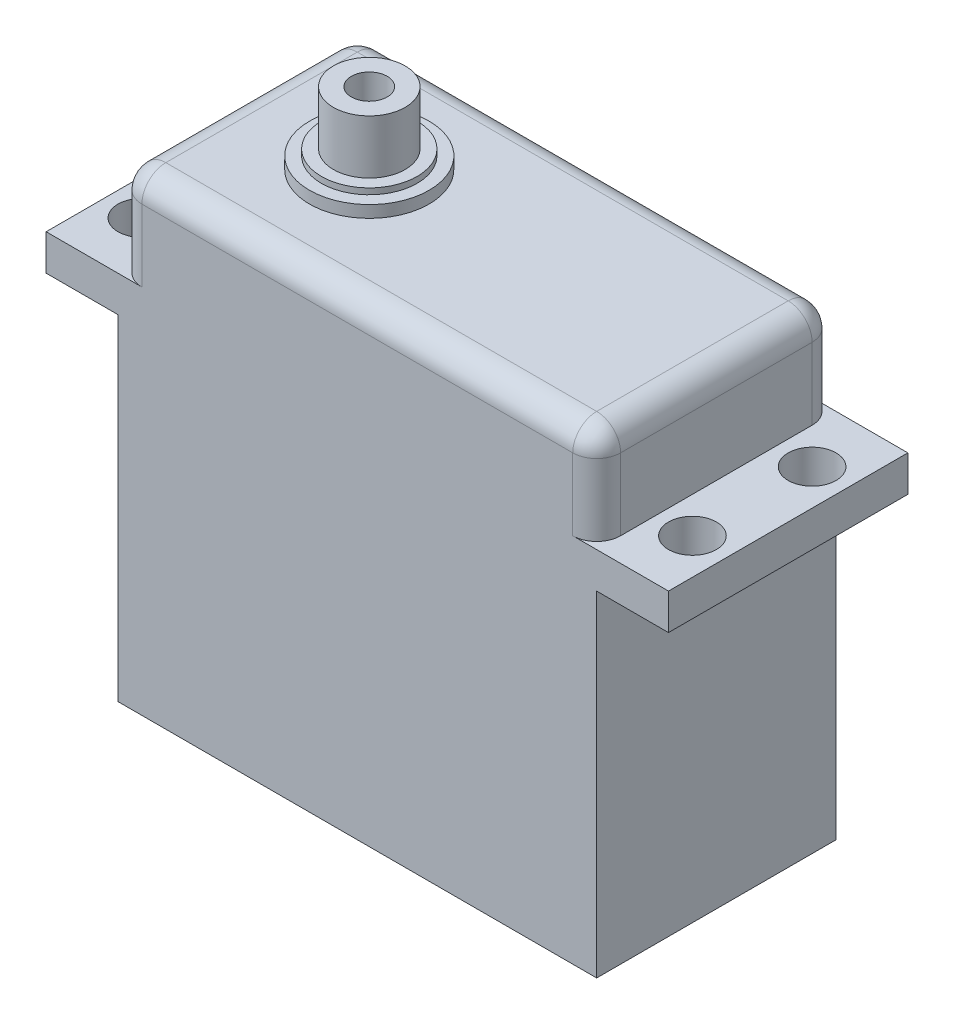
from build123d import *

# Parameters (mm, degrees)
SKETCH_2_W          = 40
SKETCH_2_H          = 39
EXTRUDE_1_DEPTH     = 20
SKETCH_3_W          = 20
SKETCH_3_H          = 3.004174972
EXTRUDE_3_DEPTH     = 6
EXTRUDE_4_DEPTH     = 6
SKETCH_6_R          = 2
CUT_EXTRUDE_7_DEPTH = 4.5
SKETCH_11_R         = 5
EXTRUDE_5_DEPTH     = 1
SKETCH_12_R         = 4
EXTRUDE_6_DEPTH     = 0.5
SKETCH_13_R         = 3
EXTRUDE_7_DEPTH     = 4.5
SKETCH_14_R         = 1.5
CUT_EXTRUDE_8_DEPTH = 7.75
FILLET_8_R          = 2


with BuildPart() as part:
    # 草图2 → 凸台-拉伸1 (new body)
    with BuildSketch(Plane.XY):
        with Locations((-1.314168378, -3.996919918)):
            Rectangle(SKETCH_2_W, SKETCH_2_H)
    extrude(amount=EXTRUDE_1_DEPTH)

    # 草图3 → 凸台-拉伸3 (add)
    with BuildSketch(Plane(origin=(18.685831622, 0, 0), x_dir=(0, 0, -1), z_dir=(1, 0, 0))):
        with Locations((-10, 6.000306797)):
            Rectangle(SKETCH_3_W, SKETCH_3_H)
    extrude(amount=EXTRUDE_3_DEPTH)

    # 草图5 → 凸台-拉伸4 (add)
    with BuildSketch(Plane.ZY.offset(21.314168378)):
        Polygon((0, 7.503080082), (0, 4.502394283), (20, 4.502394283), (20, 7.502394283), align=None)
    extrude(amount=EXTRUDE_4_DEPTH)

    # 草图6 → 切除-拉伸7 (cut, symmetric)
    with BuildSketch(Plane(origin=(0, 7.502394283, 0), x_dir=(1, 0, 0), z_dir=(0, 1, 0))):
        with Locations((21.685831622, -15)):
            Circle(SKETCH_6_R)
        with Locations((21.685831622, -5)):
            Circle(SKETCH_6_R)
        with Locations((-24.314168378, -15)):
            Circle(SKETCH_6_R)
        with Locations((-24.314168378, -5)):
            Circle(SKETCH_6_R)
    extrude(amount=CUT_EXTRUDE_7_DEPTH, both=True, mode=Mode.SUBTRACT)

    # 草图11 → 凸台-拉伸5 (add)
    with BuildSketch(Plane(origin=(0, 15.503080082, 0), x_dir=(1, 0, 0), z_dir=(0, 1, 0))):
        with Locations((-10.314168378, -10)):
            Circle(SKETCH_11_R)
    extrude(amount=EXTRUDE_5_DEPTH)

    # 草图12 → 凸台-拉伸6 (add)
    with BuildSketch(Plane(origin=(0, 16.503080082, 0), x_dir=(1, 0, 0), z_dir=(0, 1, 0))):
        with Locations((-10.314168378, -10)):
            Circle(SKETCH_12_R)
    extrude(amount=EXTRUDE_6_DEPTH)

    # 草图13 → 凸台-拉伸7 (add)
    with BuildSketch(Plane(origin=(0, 17.003080082, 0), x_dir=(1, 0, 0), z_dir=(0, 1, 0))):
        with Locations((-10.314168378, -10)):
            Circle(SKETCH_13_R)
    extrude(amount=EXTRUDE_7_DEPTH)

    # 草图14 → 切除-拉伸8 (cut, symmetric)
    with BuildSketch(Plane(origin=(0, 21.503080082, 0), x_dir=(1, 0, 0), z_dir=(0, 1, 0))):
        with Locations((-10.314168378, -10)):
            Circle(SKETCH_14_R)
    extrude(amount=CUT_EXTRUDE_8_DEPTH, both=True, mode=Mode.SUBTRACT)

    # 圆角8
    fillet_8_edges = [part.edges().sort_by_distance(p)[0] for p in [
        (-21.314168378, 15.503080082, 10),
        (-21.314168378, 11.502737183, 20),
        (-21.314168378, 11.503080082, 0),
        (-1.314168378, 15.503080082, 0),
        (18.685831622, 11.502737183, 0),
        (18.685831622, 15.503080082, 10),
        (18.685831622, 11.502737183, 20),
        (-1.314168378, 15.503080082, 20),
    ]]
    fillet(fillet_8_edges, radius=FILLET_8_R)


solid = part.part
